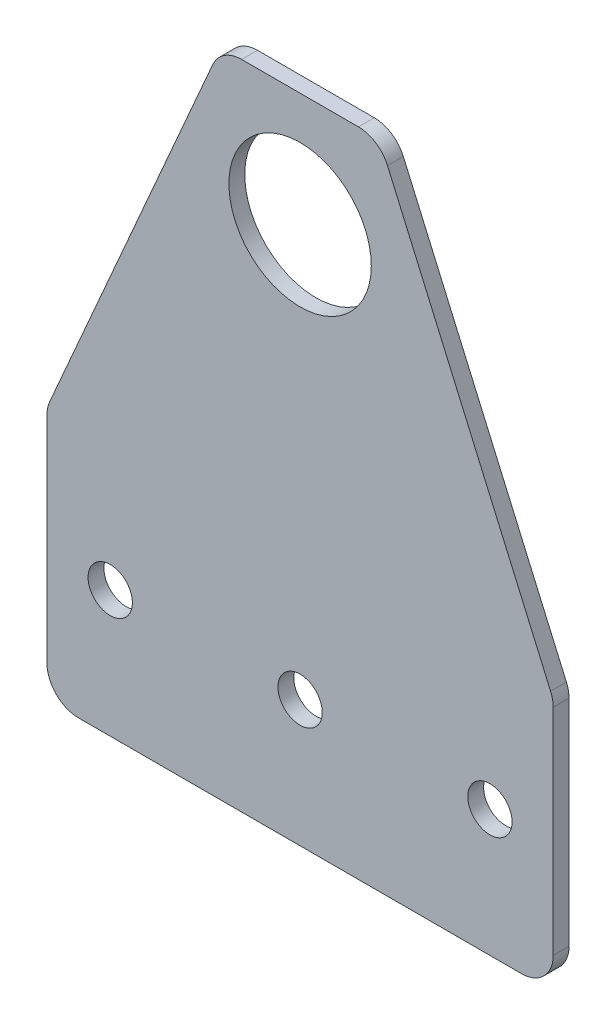
from build123d import *

# Parameters (mm, degrees)
ESQUISSE1_R        = 11.25
ESQUISSE1_R_2      = 3.5
BOSS_EXTRU_1_DEPTH = 2.5
CONG_1_R           = 5


with BuildPart() as part:
    # Esquisse1 → Boss.-Extru.1 (new body)
    with BuildSketch(Plane.XY):
        Polygon((-40, 0), (40, 0), (40, 40), (12.5, 103), (-12.5, 103), (-40, 40), align=None)
        with Locations((0, 85)):
            Circle(ESQUISSE1_R, mode=Mode.SUBTRACT)
        with Locations((0, 20)):
            Circle(ESQUISSE1_R_2, mode=Mode.SUBTRACT)
        with Locations((30, 20)):
            Circle(ESQUISSE1_R_2, mode=Mode.SUBTRACT)
        with Locations((-30, 20)):
            Circle(ESQUISSE1_R_2, mode=Mode.SUBTRACT)
    extrude(amount=BOSS_EXTRU_1_DEPTH)

    # Congé1
    cong_1_edges = [part.edges().sort_by_distance(p)[0] for p in [
        (12.5, 103, 1.25),
        (-12.5, 103, 1.25),
        (-40, 40, 1.25),
        (40, 40, 1.25),
        (40, 0, 1.25),
        (-40, 0, 1.25),
    ]]
    fillet(cong_1_edges, radius=CONG_1_R)


solid = part.part
